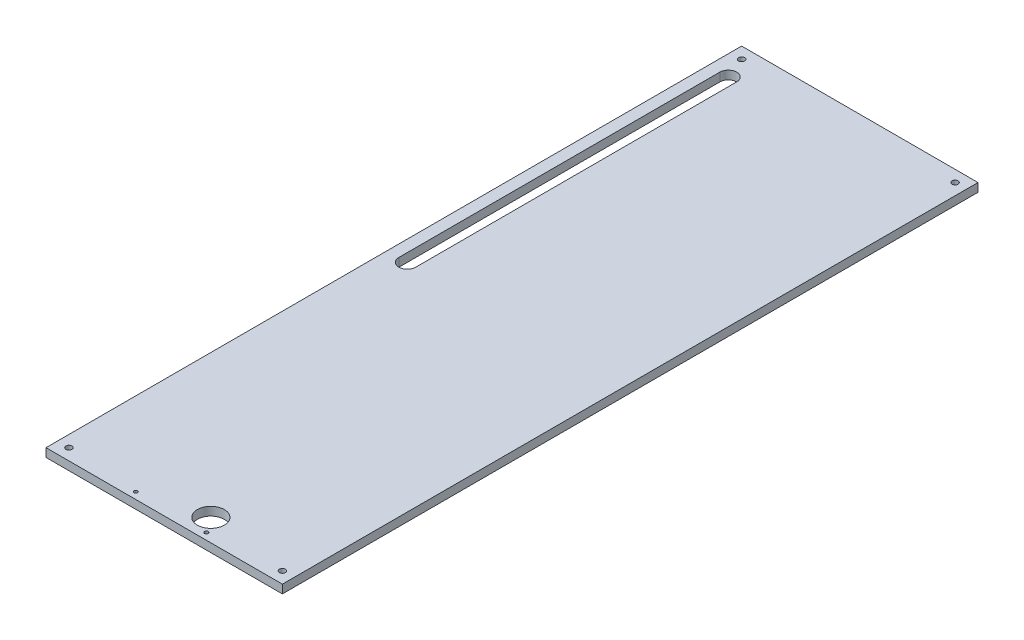
from build123d import *

# Parameters (mm, degrees)
SKETCH2_W           = 88.9
SKETCH2_H           = 3.2004
BOSS_EXTRUDE1_DEPTH = 261.62
SKETCH3_R           = 0.6731
SKETCH3_R_2         = 5.08
SKETCH3_R_3         = 1.1303
CUT_EXTRUDE1_DEPTH  = 266.665663227


with BuildPart() as part:
    # Sketch2 → Boss-Extrude1 (new body)
    with BuildSketch(Plane.XY):
        with Locations((-1.625781684, -22.993244248)):
            Rectangle(SKETCH2_W, SKETCH2_H)
    extrude(amount=BOSS_EXTRUDE1_DEPTH)

    # Sketch3 → Cut-Extrude1 (cut, through all)
    with BuildSketch(Plane(origin=(0, -21.393044248, 0), x_dir=(-1, 0, 0), z_dir=(0, 1, 0))):
        with Locations((14.833781684, 259.08)):
            Circle(SKETCH3_R)
        with Locations((-11.683818316, 259.08)):
            Circle(SKETCH3_R)
        with Locations((-7.619818316, 253.318755316)):
            Circle(SKETCH3_R_2)
        with Locations((-38.506218316, 257.302)):
            Circle(SKETCH3_R_3)
        with Locations((41.757781684, 257.302)):
            Circle(SKETCH3_R_3)
        with Locations((-38.506218316, 4.318)):
            Circle(SKETCH3_R_3)
        with Locations((41.757781684, 4.318)):
            Circle(SKETCH3_R_3)
        with BuildLine():
            Line((35.32929924, 12.595958552), (35.32929924, 133.302587666))
            ThreePointArc((35.32929924, 133.302587666), (38.50429924, 136.477587666), (41.67929924, 133.302587666))
            Line((41.67929924, 133.302587666), (41.67929924, 12.595958552))
            ThreePointArc((41.67929924, 12.595958552), (38.50429924, 9.420958552), (35.32929924, 12.595958552))
        make_face()
    extrude(amount=-CUT_EXTRUDE1_DEPTH, mode=Mode.SUBTRACT)


solid = part.part
